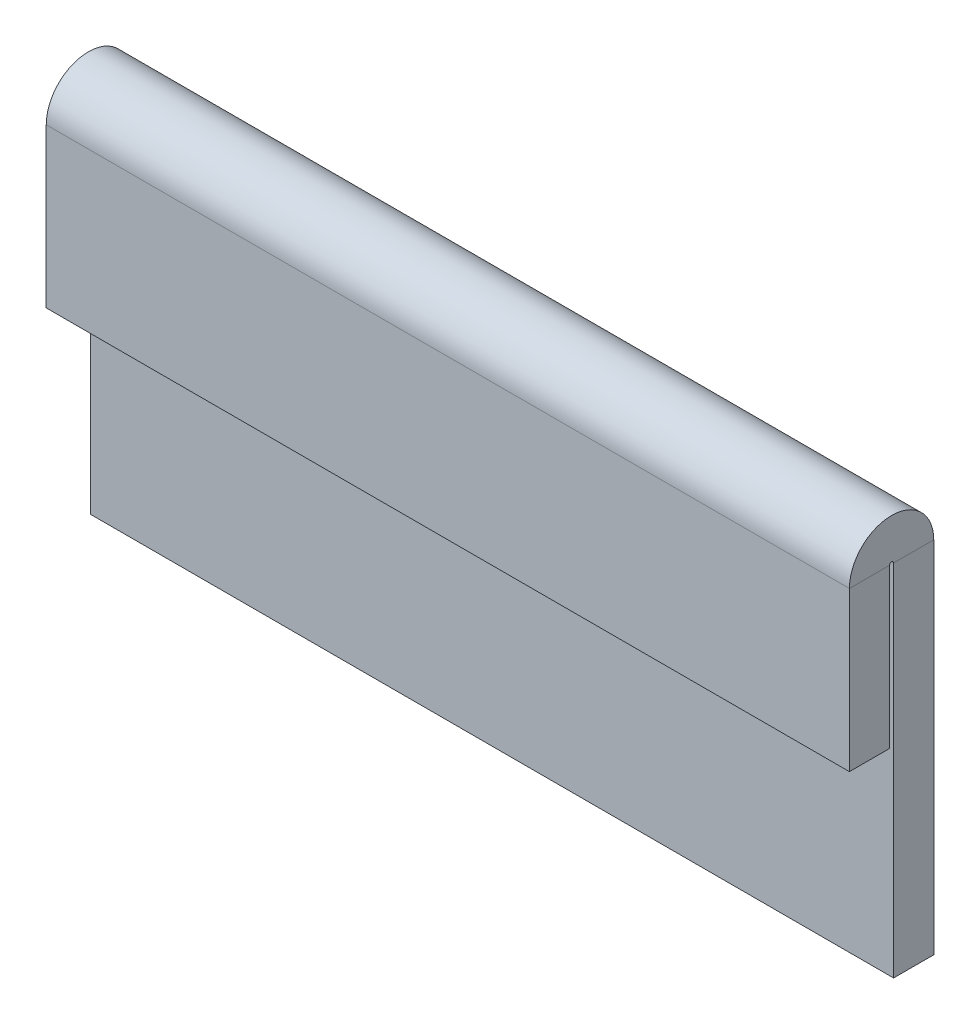
from build123d import *

# Parameters (mm, degrees)
SKETCH_1_W         = 20
SKETCH_1_H         = 10
BASEPLATE_DEPTH    = 1
HEM_CLOSED_DEPTH   = 20
HEM_CLOSED_2_DEPTH = 20


# Read off the part's stored shape, not the designer's step: Hem_closed
# Sheet-metal steps are written as plain solids
with BuildPart() as part:
    # Sketch 1 → BasePlate (new body)
    with BuildSketch(Plane.XY):
        with Locations((10, 5)):
            Rectangle(SKETCH_1_W, SKETCH_1_H)
    extrude(amount=-BASEPLATE_DEPTH)

    # Hem_closed outline → Hem_closed (cut)
    with BuildSketch(Plane.YZ):
        with BuildLine():
            Line((10, 0), (9.998808848, 0))
            ThreePointArc((9.998808848, 0), (9.674568837, -0.709934208), (8.95, -1))
            Line((8.95, -1), (10, -1))
            Line((10, -1), (10, 0))
        make_face()
    extrude(amount=HEM_CLOSED_DEPTH, mode=Mode.SUBTRACT)

    # Hem_closed 2 outline → Hem_closed 2 (add)
    with BuildSketch(Plane.YZ):
        with BuildLine():
            Line((5, 1.1), (5, 0.1))
            Line((5, 0.1), (8.95, 0.1))
            ThreePointArc((8.95, 0.1), (9, 0.05), (8.95, 0))
            Line((8.95, 0), (9.998808848, 0))
            ThreePointArc((9.998808848, 0), (9.709934208, 0.774568837), (8.95, 1.1))
            Line((8.95, 1.1), (5, 1.1))
        make_face()
    extrude(amount=HEM_CLOSED_2_DEPTH)


solid = part.part
